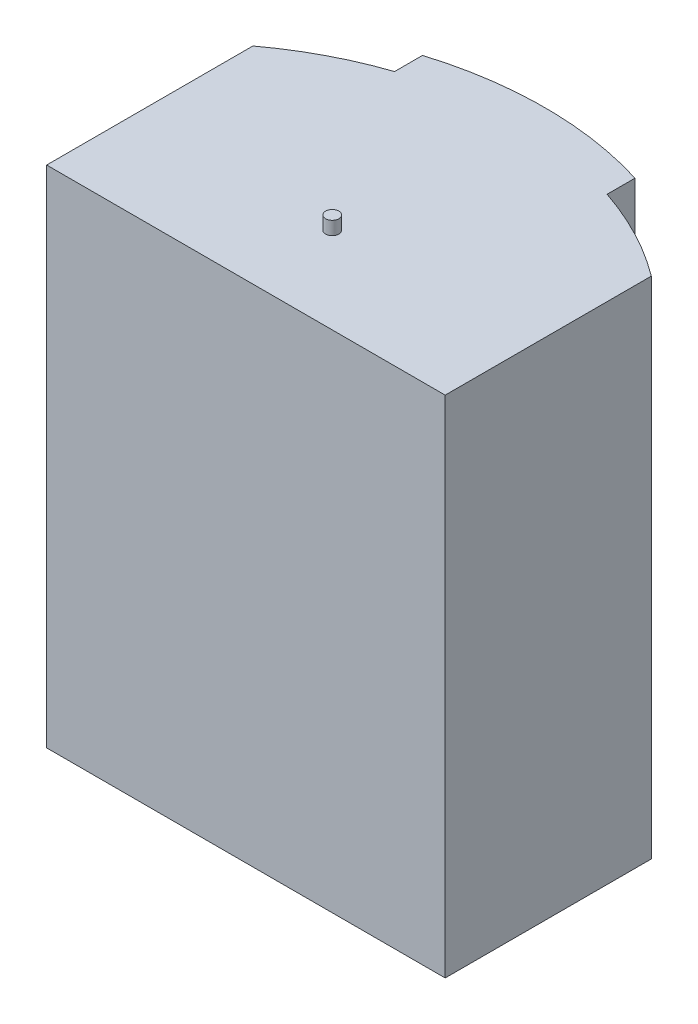
from build123d import *

# Parameters (mm, degrees)
SKETCH1_W           = 340
SKETCH1_H           = 400
BOSS_EXTRUDE1_DEPTH = 240
CAVITY2_START       = -200
CAVITY2_DEPTH       = 400
CAVITY2_2_OUTLINE_R = 5
CAVITY2_2_DEPTH     = 10
CAVITY2_START_2     = 190
CAVITY2_3_OUTLINE_R = 5
CAVITY2_3_DEPTH     = 10


# Read off the part's stored shape, not the designer's step: Cavity2
with BuildPart() as part:
    # Sketch1 → Boss-Extrude1 (new body)
    with BuildSketch(Plane.XY):
        Rectangle(SKETCH1_W, SKETCH1_H)
    extrude(amount=BOSS_EXTRUDE1_DEPTH)

    # Cavity2 outline → Cavity2 (cut)
    with BuildSketch(Plane(origin=(0, 0, 0), x_dir=(1, 0, 0), z_dir=(0, 1, 0)).offset(CAVITY2_START)):
        with BuildLine():
            Line((-80, -48.123427946), (-80, -27.108908401))
            ThreePointArc((-80, -27.108908401), (0, -15.02389766), (80, -27.108908401))
            Line((80, -27.108908401), (80, -48.123427946))
            ThreePointArc((80, -48.123427946), (116.45426588, -63.695656752), (150, -84.816535832))
            Line((150, -84.816535832), (150, -240))
            Line((150, -240), (170, -240))
            Line((170, -240), (170, 0))
            Line((170, 0), (-170, 0))
            Line((-170, 0), (-170, -240))
            Line((-170, -240), (-150, -240))
            Line((-150, -240), (-150, -84.816535832))
            ThreePointArc((-150, -84.816535832), (-116.45426588, -63.695656752), (-80, -48.123427946))
        make_face()
    extrude(amount=CAVITY2_DEPTH, mode=Mode.SUBTRACT)

    # Cavity2 2 outline → Cavity2 2 (cut)
    with BuildSketch(Plane(origin=(0, 0, 0), x_dir=(1, 0, 0), z_dir=(0, 1, 0)).offset(CAVITY2_START)):
        with BuildLine():
            ThreePointArc((80, -27.108908401), (0, -15.02389766), (-80, -27.108908401))
            Line((-80, -27.108908401), (-80, -48.123427946))
            ThreePointArc((-80, -48.123427946), (-116.45426588, -63.695656752), (-150, -84.816535832))
            Line((-150, -84.816535832), (-150, -240))
            Line((-150, -240), (150, -240))
            Line((150, -240), (150, -84.816535832))
            ThreePointArc((150, -84.816535832), (116.45426588, -63.695656752), (80, -48.123427946))
            Line((80, -48.123427946), (80, -27.108908401))
        make_face()
        with Locations((0, -175.02389766)):
            Circle(CAVITY2_2_OUTLINE_R, mode=Mode.SUBTRACT)
    extrude(amount=CAVITY2_2_DEPTH, mode=Mode.SUBTRACT)

    # Cavity2 3 outline → Cavity2 3 (cut)
    with BuildSketch(Plane(origin=(0, 0, 0), x_dir=(1, 0, 0), z_dir=(0, 1, 0)).offset(CAVITY2_START_2)):
        with BuildLine():
            ThreePointArc((80, -27.108908401), (0, -15.02389766), (-80, -27.108908401))
            Line((-80, -27.108908401), (-80, -48.123427946))
            ThreePointArc((-80, -48.123427946), (-116.45426588, -63.695656752), (-150, -84.816535832))
            Line((-150, -84.816535832), (-150, -240))
            Line((-150, -240), (150, -240))
            Line((150, -240), (150, -84.816535832))
            ThreePointArc((150, -84.816535832), (116.45426588, -63.695656752), (80, -48.123427946))
            Line((80, -48.123427946), (80, -27.108908401))
        make_face()
        with Locations((0, -175.02389766)):
            Circle(CAVITY2_3_OUTLINE_R, mode=Mode.SUBTRACT)
    extrude(amount=CAVITY2_3_DEPTH, mode=Mode.SUBTRACT)


solid = part.part
